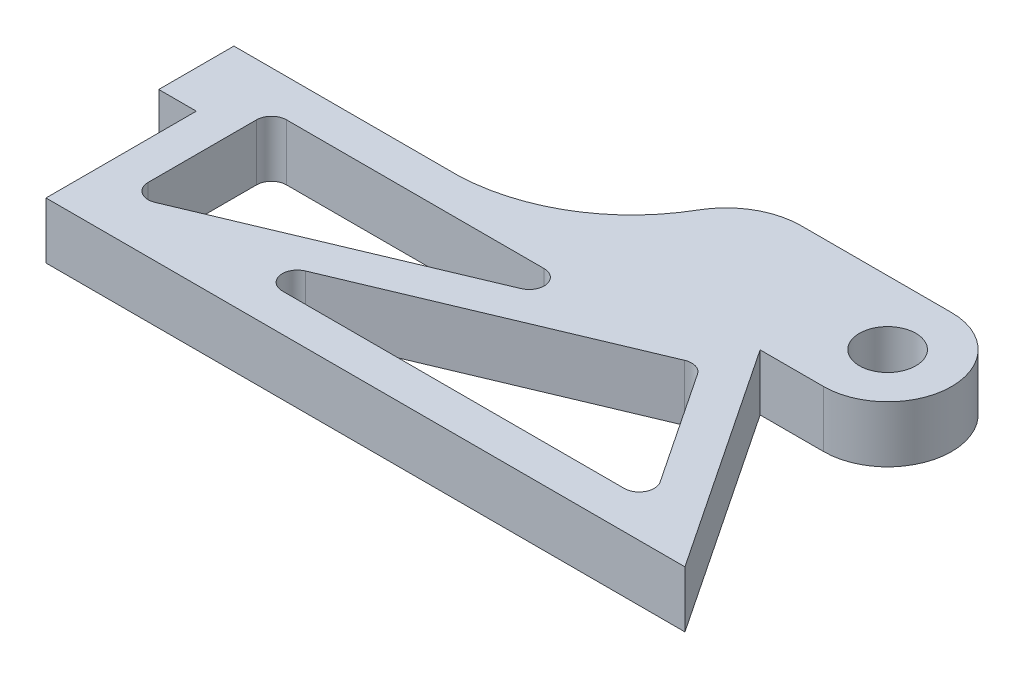
from build123d import *

# Parameters (mm, degrees)
SKETCH1_R           = 4.7625
BOSS_EXTRUDE1_DEPTH = 9.525
FILLET6_R           = 2.54


with BuildPart() as part:
    # Sketch1 → Boss-Extrude1 (new body)
    with BuildSketch(Plane(origin=(0, 0, 0), x_dir=(1, 0, 0), z_dir=(0, 1, 0))):
        with BuildLine():
            Line((0, 0), (38.1, 0))
            ThreePointArc((38.1, 0), (52.620300687, 4.403064286), (63.218539249, 15.261399634))
            ThreePointArc((63.218539249, 15.261399634), (67.86863694, 19.924564568), (74.228922018, 21.631986448))
            Line((74.228922018, 21.631986448), (99.628922018, 21.631986448))
            ThreePointArc((99.628922018, 21.631986448), (110.444915242, 10.815993224), (99.628922018, 0))
            Line((99.628922018, 0), (88.9, 0))
            Line((88.9, 0), (114.3, -38.1))
            Line((114.3, -38.1), (6.35, -38.1))
            Line((6.35, -38.1), (6.35, -12.7))
            Line((6.35, -12.7), (0, -12.7))
            Line((0, -12.7), (0, 0))
        make_face()
        with Locations((99.628922018, 10.815993224)):
            Circle(SKETCH1_R, mode=Mode.SUBTRACT)
        Polygon((85.993351145, -7.087652017), (102.434916467, -31.75), (27.330311809, -31.75), align=None, mode=Mode.SUBTRACT)
        Polygon((12.7, -31.012347983), (12.7, -6.35), (71.363039336, -6.35), align=None, mode=Mode.SUBTRACT)
    extrude(amount=BOSS_EXTRUDE1_DEPTH)

    # Fillet6
    fillet6_edges = [part.edges().sort_by_distance(p)[0] for p in [
        (102.434916467, 4.7625, 31.75),
        (85.993351145, 4.7625, 7.087652017),
        (27.330311809, 4.7625, 31.75),
        (12.7, 4.7625, 31.012347983),
        (12.7, 4.7625, 6.35),
        (71.363039336, 4.7625, 6.35),
    ]]
    fillet(fillet6_edges, radius=FILLET6_R)


solid = part.part
